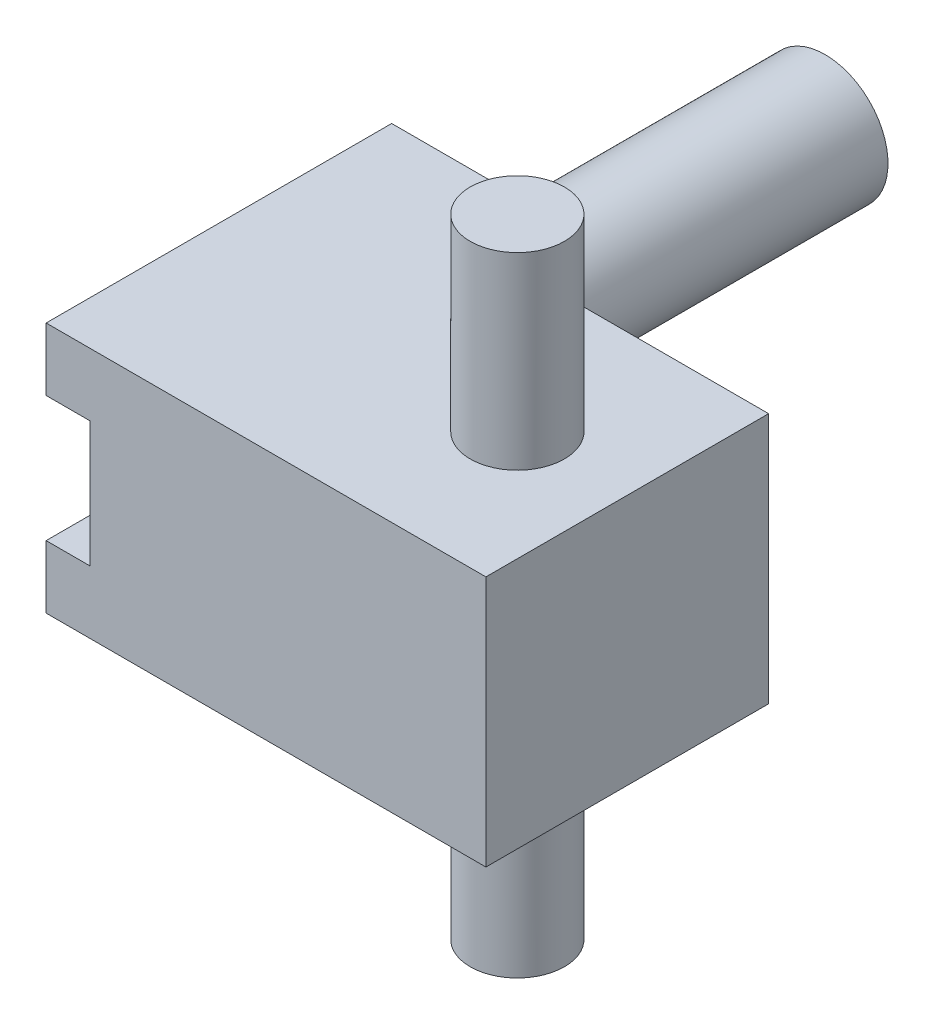
from build123d import *

# Parameters (mm, degrees)
CROQUIS2_W              = 70
CROQUIS2_H              = 40
SALIENTE_EXTRUIR1_DEPTH = 45
CROQUIS3_W              = 40.5
CROQUIS3_H              = 20
CORTAR_EXTRUIR1_DEPTH   = 39
CROQUIS4_W              = 7
CROQUIS4_H              = 20
CORTAR_EXTRUIR2_DEPTH   = 12
CROQUIS5_W              = 20
CROQUIS5_H              = 20
CORTAR_EXTRUIR4_DEPTH   = 7
CROQUIS6_R              = 7.5
SALIENTE_EXTRUIR3_DEPTH = 30
SALIENTE_EXTRUIR4_START = 30
CROQUIS8_R              = 7.5
SALIENTE_EXTRUIR4_DEPTH = 30
CROQUIS9_W              = 30
CROQUIS9_H              = 40
SALIENTE_EXTRUIR5_DEPTH = 10
CROQUIS10_R             = 10
SALIENTE_EXTRUIR6_DEPTH = 54


with BuildPart() as part:
    # Croquis2 → Saliente-Extruir1 (new body)
    with BuildSketch(Plane.XY):
        with Locations((35, 20)):
            Rectangle(CROQUIS2_W, CROQUIS2_H)
    extrude(amount=SALIENTE_EXTRUIR1_DEPTH)

    # Croquis3 → Cortar-Extruir1 (cut)
    with BuildSketch(Plane(origin=(0, 0, 0), x_dir=(-1, 0, 0), z_dir=(0, 0, -1))):
        with Locations((-27.25, 20)):
            Rectangle(CROQUIS3_W, CROQUIS3_H)
    extrude(amount=-CORTAR_EXTRUIR1_DEPTH, mode=Mode.SUBTRACT)

    # Croquis4 → Cortar-Extruir2 (cut)
    with BuildSketch(Plane(origin=(0, 0, 0), x_dir=(-1, 0, 0), z_dir=(0, 0, -1))):
        with Locations((-3.5, 20)):
            Rectangle(CROQUIS4_W, CROQUIS4_H)
        with Locations((-51, 20)):
            Rectangle(CROQUIS4_W, CROQUIS4_H)
    extrude(amount=-CORTAR_EXTRUIR2_DEPTH, mode=Mode.SUBTRACT)

    # Croquis5 → Cortar-Extruir4 (cut)
    with BuildSketch(Plane.ZY):
        with Locations((35, 20)):
            Rectangle(CROQUIS5_W, CROQUIS5_H)
    extrude(amount=-CORTAR_EXTRUIR4_DEPTH, mode=Mode.SUBTRACT)

    # Croquis6 → Saliente-Extruir3 (add)
    with BuildSketch(Plane(origin=(0, 40, 0), x_dir=(1, 0, 0), z_dir=(0, 1, 0))):
        with Locations((52.5, -22.5)):
            Circle(CROQUIS6_R)
    extrude(amount=SALIENTE_EXTRUIR3_DEPTH)

    # Croquis8 → Saliente-Extruir4 (add)
    with BuildSketch(Plane.XZ.offset(SALIENTE_EXTRUIR4_START)):
        with Locations((52.5, 22.5)):
            Circle(CROQUIS8_R)
    extrude(amount=-SALIENTE_EXTRUIR4_DEPTH)

    # Croquis9 → Saliente-Extruir5 (add)
    with BuildSketch(Plane(origin=(0, 0, 0), x_dir=(-1, 0, 0), z_dir=(0, 0, -1))):
        with Locations((-15, 20)):
            Rectangle(CROQUIS9_W, CROQUIS9_H)
    extrude(amount=SALIENTE_EXTRUIR5_DEPTH)

    # Croquis10 → Saliente-Extruir6 (add)
    with BuildSketch(Plane(origin=(0, 0, -10), x_dir=(-1, 0, 0), z_dir=(0, 0, -1))):
        with Locations((-15, 20)):
            Circle(CROQUIS10_R)
    extrude(amount=SALIENTE_EXTRUIR6_DEPTH)


solid = part.part
